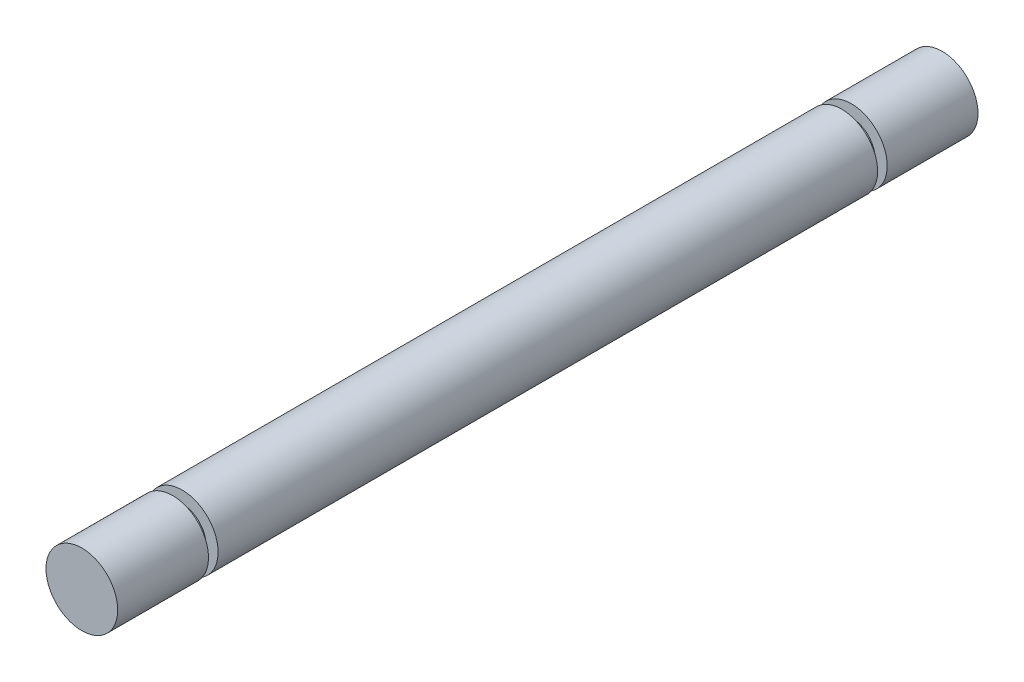
from build123d import *

# Parameters (mm, degrees)
SKETCH1_R           = 4.7625
BOSS_EXTRUDE1_DEPTH = 87.63
SKETCH2_R           = 3.175
BOSS_EXTRUDE2_DEPTH = 1.27
BOSS_EXTRUDE3_START = 12.065
SKETCH3_R           = 4.7625
BOSS_EXTRUDE3_DEPTH = 12.065
BOSS_EXTRUDE4_START = 1.27
SKETCH4_R           = 3.175
BOSS_EXTRUDE4_DEPTH = 1.27
SKETCH5_R           = 4.7625
BOSS_EXTRUDE5_DEPTH = 12.065


with BuildPart() as part:
    # Sketch1 → Boss-Extrude1 (new body)
    with BuildSketch(Plane.XY):
        Circle(SKETCH1_R)
    extrude(amount=BOSS_EXTRUDE1_DEPTH)

    # Sketch2 → Boss-Extrude2 (add)
    with BuildSketch(Plane(origin=(0, 0, 0), x_dir=(-1, 0, 0), z_dir=(0, 0, -1))):
        Circle(SKETCH2_R)
    extrude(amount=BOSS_EXTRUDE2_DEPTH)

    # Sketch3 → Boss-Extrude3 (add)
    with BuildSketch(Plane(origin=(0, 0, -1.27), x_dir=(-1, 0, 0), z_dir=(0, 0, -1)).offset(BOSS_EXTRUDE3_START)):
        Circle(SKETCH3_R)
    extrude(amount=-BOSS_EXTRUDE3_DEPTH)

    # Sketch4 → Boss-Extrude4 (add)
    with BuildSketch(Plane.XY.offset(87.63).offset(BOSS_EXTRUDE4_START)):
        Circle(SKETCH4_R)
    extrude(amount=-BOSS_EXTRUDE4_DEPTH)

    # Sketch5 → Boss-Extrude5 (add)
    with BuildSketch(Plane.XY.offset(88.9)):
        Circle(SKETCH5_R)
    extrude(amount=BOSS_EXTRUDE5_DEPTH)


solid = part.part
